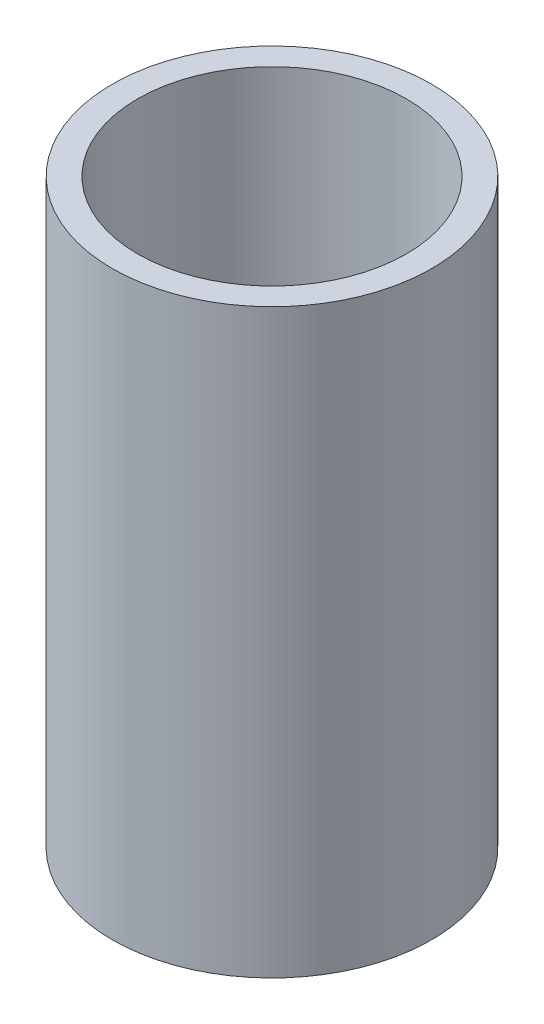
from build123d import *

# Parameters (mm, degrees)
SKETCH1_R           = 30
BOSS_EXTRUDE1_DEPTH = 109.205464953
SKETCH2_R           = 25.242752207
CUT_EXTRUDE1_DEPTH  = 118.157302698


with BuildPart() as part:
    # Sketch1 → Boss-Extrude1 (new body)
    with BuildSketch(Plane(origin=(0, 0, 0), x_dir=(1, 0, 0), z_dir=(0, 1, 0))):
        Circle(SKETCH1_R)
    extrude(amount=BOSS_EXTRUDE1_DEPTH)

    # Sketch2 → Cut-Extrude1 (cut, through all)
    with BuildSketch(Plane(origin=(0, 0, 0), x_dir=(1, 0, 0), z_dir=(0, 1, 0))):
        Circle(SKETCH2_R)
    extrude(amount=CUT_EXTRUDE1_DEPTH, mode=Mode.SUBTRACT)


solid = part.part
